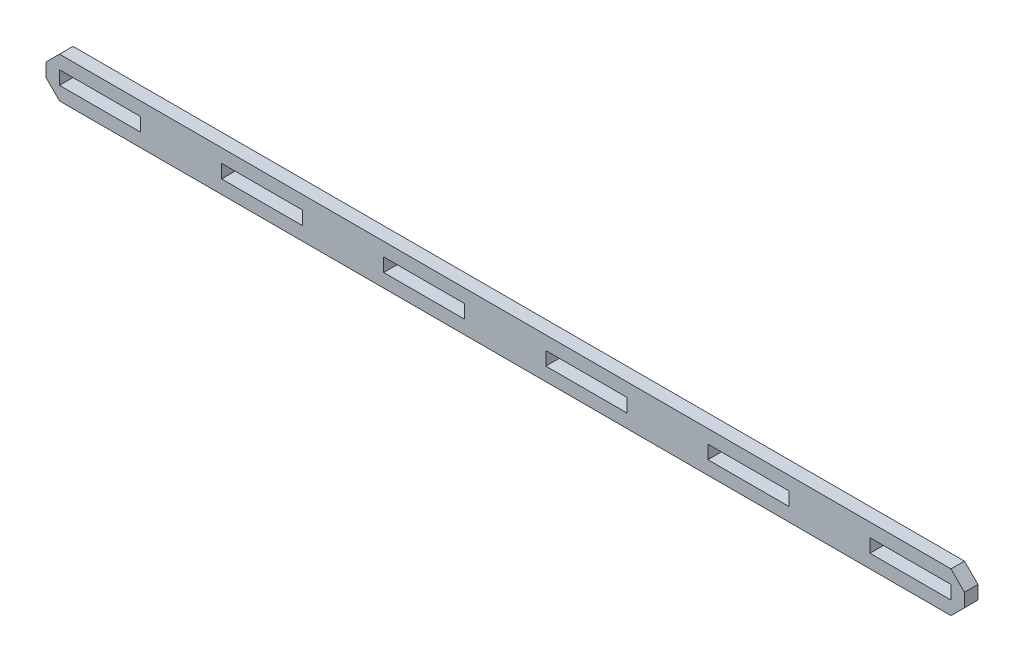
from build123d import *

# Parameters (mm, degrees)
SKETCH2_W           = 30
SKETCH2_H           = 5
BOSS_EXTRUDE1_DEPTH = 5


with BuildPart() as part:
    # Sketch2 → Boss-Extrude1 (new body)
    with BuildSketch(Plane.XY):
        Polygon((-57.040816327, 9.797954749), (272.959183673, 9.797954749), (277.959183673, 4.797954749), (277.959183673, -0.202045251), (272.959183673, -5.202045251), (-57.040816327, -5.202045251), (-62.040816327, -0.202045251), (-62.040816327, 4.797954749), align=None)
        with Locations((17.959183673, 2.297954749)):
            Rectangle(SKETCH2_W, SKETCH2_H, mode=Mode.SUBTRACT)
        with Locations((77.959183673, 2.297954749)):
            Rectangle(SKETCH2_W, SKETCH2_H, mode=Mode.SUBTRACT)
        with Locations((-42.040816327, 2.297954749)):
            Rectangle(SKETCH2_W, SKETCH2_H, mode=Mode.SUBTRACT)
        with Locations((257.959183673, 2.297954749)):
            Rectangle(SKETCH2_W, SKETCH2_H, mode=Mode.SUBTRACT)
        with Locations((197.959183673, 2.297954749)):
            Rectangle(SKETCH2_W, SKETCH2_H, mode=Mode.SUBTRACT)
        with Locations((137.959183673, 2.297954749)):
            Rectangle(SKETCH2_W, SKETCH2_H, mode=Mode.SUBTRACT)
    extrude(amount=BOSS_EXTRUDE1_DEPTH)


solid = part.part
